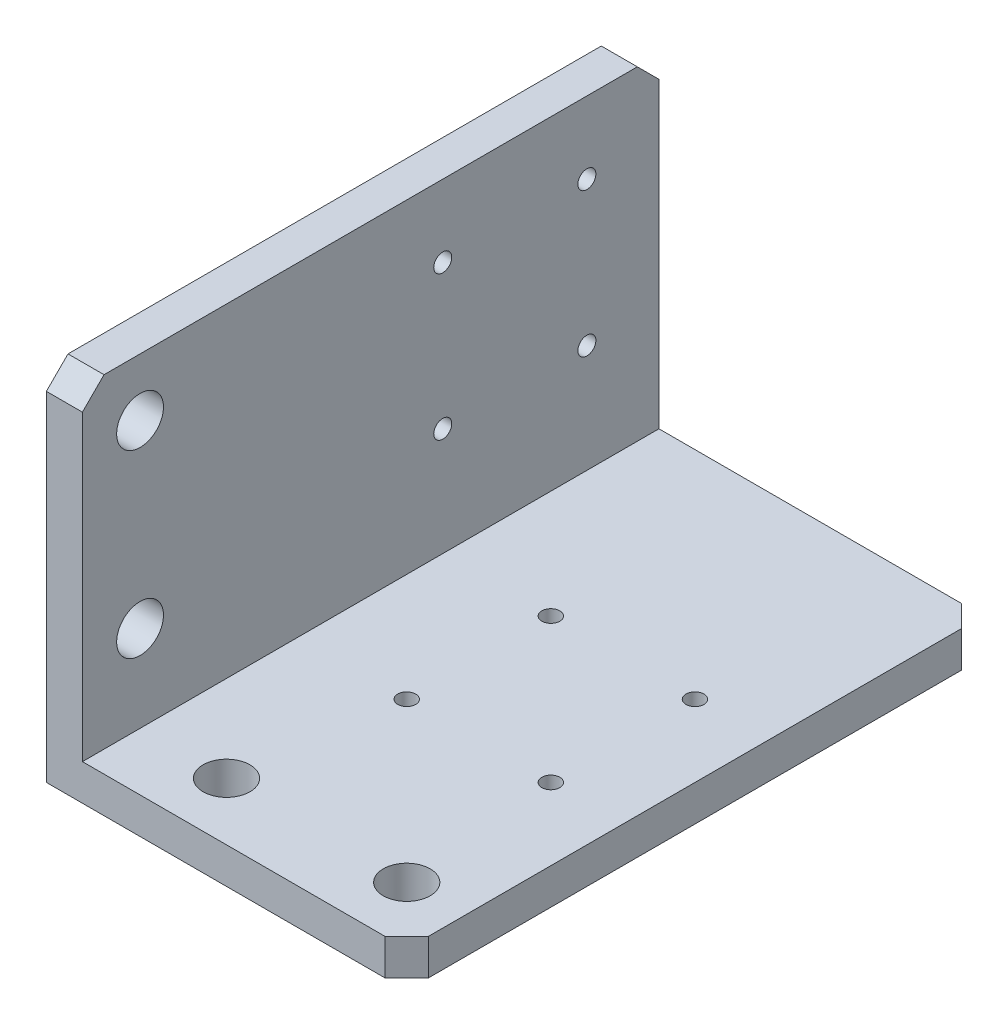
from build123d import *

# Parameters (mm, degrees)
ESTRUSIONE_ESTRUSIONE1_DEPTH = 80
FORO_6_5_6_5_1_D             = 6.5
FORO_6_5_6_5_2_D             = 6.5
FORO_6_5_6_5_2_DEPTH         = 5
FORO_6_5_6_5_2_TIP           = 1.952797012
SMUSSO1_SIZE                 = 3
M3_TAPPED_HOLE1_D            = 2.5
M3_TAPPED_HOLE2_D            = 2.5


with BuildPart() as part:
    # Schizzo1 → Estrusione-Estrusione1 (new body)
    with BuildSketch(Plane.XY):
        Polygon((0, 0), (0, 50), (5, 50), (5, 5), (50, 5), (50, 0), align=None)
    extrude(amount=ESTRUSIONE_ESTRUSIONE1_DEPTH)

    # Foro Ø6.5 (6.5)-1 (through all)
    with Locations(Plane(origin=(0, 0, 0), x_dir=(-1, 0, 0), z_dir=(0, -1, 0))):
        with Locations((-17, -72), (-42, -72)):
            Hole(FORO_6_5_6_5_1_D / 2)

    # Foro Ø6.5 (6.5)-2
    with Locations(Plane.ZY):
        with Locations((72, 42), (72, 17)):
            Hole(FORO_6_5_6_5_2_D / 2, depth=FORO_6_5_6_5_2_DEPTH)
            with Locations((0, 0, -(FORO_6_5_6_5_2_DEPTH + FORO_6_5_6_5_2_TIP / 2))):  # 118° drill point
                Cone(0, FORO_6_5_6_5_2_D / 2, FORO_6_5_6_5_2_TIP, mode=Mode.SUBTRACT)

    # Smusso1
    smusso1_edges = [part.edges().sort_by_distance(p)[0] for p in [
        (2.5, 50, 0),
        (50, 2.5, 0),
        (2.5, 50, 80),
        (50, 2.5, 80),
    ]]
    chamfer(smusso1_edges, length=SMUSSO1_SIZE)

    # M3 Tapped Hole1 (through all)
    with Locations(Plane(origin=(0, 40, 10), x_dir=(0, 0, -1), z_dir=(-1, 0, 0))):
        with Locations((0, 0), (-20, 0), (-20, 20), (0, 20)):
            Hole(M3_TAPPED_HOLE1_D / 2)

    # M3 Tapped Hole2 (through all)
    with Locations(Plane(origin=(20, 0, 50), x_dir=(-1, 0, 0), z_dir=(0, -1, 0))):
        with Locations((0, 0), (-20, 0), (-20, 20), (0, 20)):
            Hole(M3_TAPPED_HOLE2_D / 2)


solid = part.part
